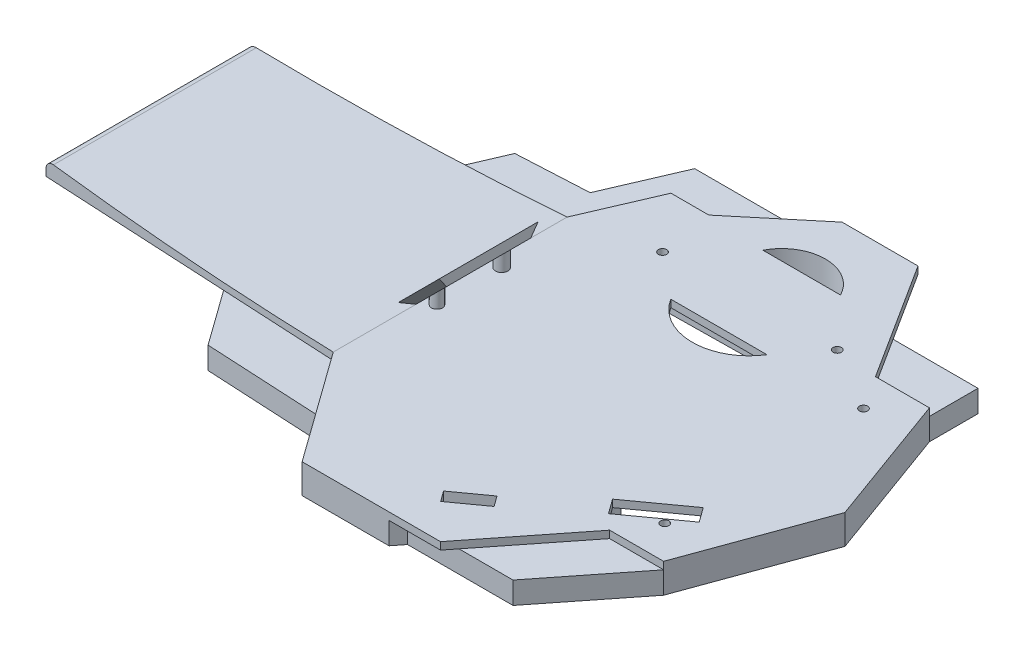
from build123d import *

# Parameters (mm, degrees)
EXTRUDE_1_DEPTH               = 2
EXTRUDE_2_DEPTH               = 2
CUT_EXTRUDE_3_DEPTH           = 202.869395429
CUT_EXTRUDE_3_DEPTH_BACK      = 202.869395429
FILLET_1_R                    = 2
EXTRUDE_4_DEPTH               = 6
CUT_EXTRUDE_7_DEPTH           = 202.98824919
EXTRUDE_5_DEPTH               = 2
EXTRUDE_5_DRAFT               = -45
EXTRUDE_11_REACH              = 204.137
SKETCH_24_R                   = 1.697293379
SKETCH_24_R_2                 = 1.5
CUT_EXTRUDE_8_DEPTH           = 203.13682253
SKETCH_26_W                   = 1.1303
SKETCH_26_H                   = 10
HOLE_WIZARD_4_40_3_AT_2_COUNT = 2
HOLE_WIZARD_4_40_3_AT_2_PITCH = 54.095245987
SKETCH_29_R                   = 3
EXTRUDE_14_DEPTH              = 5
SKETCH_32_W                   = 1.1303
SKETCH_32_H                   = 8
HOLE_WIZARD_4_40_4_AT_2_COUNT = 2
HOLE_WIZARD_4_40_4_AT_2_PITCH = 46.874028211


with BuildPart() as part:
    # 草图2 → 凸台-拉伸1 (new body)
    with BuildSketch(Plane(origin=(0, 0, 0), x_dir=(1, 0, 0), z_dir=(0, 1, 0))):
        Polygon((141.821582241, 68.082690978), (121.161879345, 68.082690978), (101.35099463, 51.608897425), (91.039832206, 51.608897425), (82.527346571, 31.825074964), (0, 27.5), (0, -27.5), (82.527346571, -31.825074964), (104.14664553, -61.917309022), (141.821582241, -61.917309022), (162.133732132, -36.18552755), (176.829545061, -36.18552755), (190, 0), (176.829545061, 36.18552755), (162.133732132, 36.18552755), align=None)
    extrude(amount=EXTRUDE_1_DEPTH)

    # 草图6 → 凸台-拉伸2 (add)
    with BuildSketch(Plane(origin=(0, 2, 0), x_dir=(1, 0, 0), z_dir=(0, 1, 0))):
        Polygon((82.527346571, 31.825074964), (82.527346571, -31.825074964), (0, -27.5), (0, 27.5), align=None)
    extrude(amount=EXTRUDE_2_DEPTH)

    # 草图7 → 切除-拉伸3 (cut, two sides: drawn at the far end of the back side and taken through both)
    with BuildSketch(Plane.XY.offset(-CUT_EXTRUDE_3_DEPTH_BACK)):
        with BuildLine():
            Line((82.527346571, 2), (82.527346571, 30.740821148))
            Line((82.527346571, 30.740821148), (0, 4))
            add(Edge.make_bspline(
                [(82.527346571, 2), (41.215261335, 1.001172546), (0, 4)],
                knots=[0, 0, 0, 1, 1, 1], degree=2))
        make_face()
    extrude(amount=CUT_EXTRUDE_3_DEPTH + CUT_EXTRUDE_3_DEPTH_BACK, mode=Mode.SUBTRACT)

    # 圆角1
    fillet_1_edges = [part.edges().sort_by_distance(p)[0] for p in [
        (0, 4, 13.75),
    ]]
    fillet(fillet_1_edges, radius=FILLET_1_R)

    # 草图13 → 凸台-拉伸4 (add)
    with BuildSketch(Plane.XZ):
        Polygon((53.501507434, -30.303895193), (58.412275987, -41.716986195), (77.926898746, -42.739704237), (86.484415452, -62.62818317), (136.164724768, -62.62818317), (144.584081331, -49.40685536), (176.829545061, -49.40685536), (176.829545061, -36.18552755), (190, 0), (176.829545061, 36.18552755), (158.743204348, 59.097615602), (130.016377906, 59.097615602), (127.790568727, 61.917309022), (104.14664553, 61.917309022), (93.336996051, 46.871191993), (61.845926158, 45.220814953), (51.036276678, 30.174697924), (171.852914921, 31.825074964), (171.852914921, -31.825074964), align=None)
    extrude(amount=EXTRUDE_4_DEPTH)

    # 草图18 → 切除-拉伸7 (cut, through all)
    with BuildSketch(Plane(origin=(0, 2, 0), x_dir=(1, 0, 0), z_dir=(0, 1, 0))):
        Polygon((169.563862496, -18.125868021), (155.218286362, -28.471875769), (158.085778721, -32.447885738), (172.431354854, -22.101877989), align=None)
        Polygon((130.302091903, -49.564637909), (132.361562224, -52.420260001), (140.814695434, -46.323873151), (138.755225113, -43.468251059), align=None)
    extrude(amount=-CUT_EXTRUDE_7_DEPTH, mode=Mode.SUBTRACT)

    # 草图17 → 切除-拉伸8 (cut, through all)
    with BuildSketch(Plane(origin=(0, 2, 0), x_dir=(1, 0, 0), z_dir=(0, 1, 0))):
        with BuildLine():
            Line((142.181150975, 26.59529287), (116.011181983, 26.59529287))
            ThreePointArc((116.011181983, 26.59529287), (129.096166479, 19.355270398), (142.181150975, 26.59529287))
        make_face()
        with BuildLine():
            Line((116.98958299, 50.681307574), (138.127410429, 50.681307574))
            ThreePointArc((138.127410429, 50.681307574), (127.55849671, 57.129732827), (116.98958299, 50.681307574))
        make_face()
    extrude(amount=-CUT_EXTRUDE_8_DEPTH, mode=Mode.SUBTRACT)

    # 草图26 → #4-40 螺纹孔3 (revolve, cut)
    with BuildSketch(Plane(origin=(168.015540482, 4, 27.047622993), x_dir=(0, 0, 1), z_dir=(1, 0, 0))):
        with Locations((0.56515, 5)):
            Rectangle(SKETCH_26_W, SKETCH_26_H)
    hole_wizard_4_40_3 = revolve(axis=Axis((168.015540482, 10.35, 27.047622993), (0, -1, 0)), mode=Mode.SUBTRACT)

    # #4-40 螺纹孔3 at 2: #4-40 螺纹孔3 ×2
    with Locations(*[(0, 0, -i * HOLE_WIZARD_4_40_3_AT_2_PITCH) for i in range(1, HOLE_WIZARD_4_40_3_AT_2_COUNT)]):
        add(hole_wizard_4_40_3, mode=Mode.SUBTRACT)

    # 草图29 → 凸台-拉伸14 (add)
    with BuildSketch(Plane.XZ):
        with Locations((67.061317629, 25.566411224)):
            Circle(SKETCH_29_R)
        with Locations((67.061317629, -25.566411224)):
            Circle(SKETCH_29_R)
        with Locations((150.788762168, 25.939901438)):
            Circle(SKETCH_29_R)
        with Locations((150.788762168, -25.939901438)):
            Circle(SKETCH_29_R)
    extrude(amount=EXTRUDE_14_DEPTH)

    # 草图32 → #4-40 螺纹孔4 (revolve, cut)
    with BuildSketch(Plane(origin=(150.618185797, 2, -37.306980555), x_dir=(0, 0, 1), z_dir=(1, 0, 0))):
        with Locations((0.56515, 4)):
            Rectangle(SKETCH_32_W, SKETCH_32_H)
    hole_wizard_4_40_4 = revolve(axis=Axis((150.618185797, 8.35, -37.306980555), (0, -1, 0)), mode=Mode.SUBTRACT)

    # #4-40 螺纹孔4 at 2: #4-40 螺纹孔4 ×2
    with Locations(*[Vector(-0.9998888796943366, 0, 0.014907322482742088) * (i * HOLE_WIZARD_4_40_4_AT_2_PITCH) for i in range(1, HOLE_WIZARD_4_40_4_AT_2_COUNT)]):
        add(hole_wizard_4_40_4, mode=Mode.SUBTRACT)


with BuildPart() as body_2:
    # 草图23 → 凸台-拉伸5 (with draft: the straight prism first)
    with BuildSketch(Plane(origin=(40.263673286, -40.263673286, 0), x_dir=(0, 0, -1), z_dir=(-0.7071067811865488, 0.7071067811865464, 0))):
        Polygon((-9.292036768, -59.769859956), (-9.292036768, -60.809778756), (-9.292036768, -71.520555916), (13.638077716, -71.520555916), (13.638077716, -59.769859956), align=None)
    extrude(amount=EXTRUDE_5_DEPTH)
    # 凸台-拉伸5: the draft: its side faces are tilted about the plane it starts from
    extrude_5_sides = [body_2.faces().sort_by_distance(p)[0] for p in [
        (85.974738189, 6.86160518, 9.292036768),
        (85.974738189, 6.86160518, -13.638077716),
        (90.129236587, 11.016103578, -2.173020474),
        (81.82023979, 2.707106781, -2.173020474),
    ]]
    draft(extrude_5_sides, Plane(origin=(40.263673286, -40.263673286, 0), x_dir=(0, 0, -1), z_dir=(-0.7071067811865488, 0.7071067811865464, 0)), EXTRUDE_5_DRAFT)


with BuildPart() as body_3:
    # 凸台-拉伸11: up to this plane
    extrude_11_end = Plane(origin=(40.263673286, -40.263673286, 0), z_dir=(0.7071067811865476, -0.7071067811865476, 0))
    # 草图24 → 凸台-拉伸11 (new, up to the surface)
    with BuildSketch(Plane(origin=(0, 2, 0), x_dir=(1, 0, 0), z_dir=(0, 1, 0)), mode=Mode.PRIVATE) as extrude_11_sk1:
        with Locations((85.490261725, 11.047785882)):
            Circle(SKETCH_24_R)
    extrude_11_tool1 = split(extrude(extrude_11_sk1.sketch, amount=EXTRUDE_11_REACH, mode=Mode.PRIVATE), bisect_by=extrude_11_end, keep=Keep.BOTH, mode=Mode.PRIVATE)
    add(extrude_11_tool1.solids().sort_by_distance((85.490262, 2, -11.047786))[0])
    # 草图24 → 凸台-拉伸11 (new, up to the surface)
    with BuildSketch(Plane(origin=(0, 2, 0), x_dir=(1, 0, 0), z_dir=(0, 1, 0)), mode=Mode.PRIVATE) as extrude_11_sk2:
        with Locations((85.490261725, -6.54134788)):
            Circle(SKETCH_24_R_2)
    extrude_11_tool2 = split(extrude(extrude_11_sk2.sketch, amount=EXTRUDE_11_REACH, mode=Mode.PRIVATE), bisect_by=extrude_11_end, keep=Keep.BOTH, mode=Mode.PRIVATE)
    add(extrude_11_tool2.solids().sort_by_distance((85.490262, 2, 6.541348))[0])


solid = Compound([part.part, body_2.part, body_3.part])
